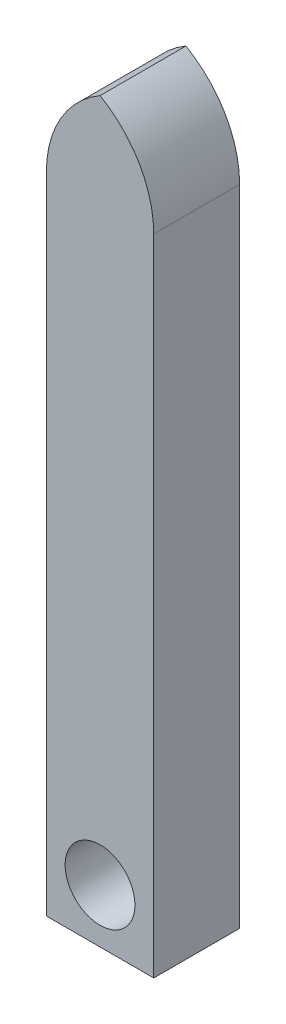
from build123d import *

# Parameters (mm, degrees)
SKETCH1_W           = 5
SKETCH1_H           = 35
SKETCH1_R           = 1.625
BOSS_EXTRUDE1_DEPTH = 4
FILLET1_R           = 5


with BuildPart() as part:
    # Sketch1 → Boss-Extrude1 (new body)
    with BuildSketch(Plane.XY):
        Rectangle(SKETCH1_W, SKETCH1_H)
        with Locations((0, -15)):
            Circle(SKETCH1_R, mode=Mode.SUBTRACT)
    extrude(amount=BOSS_EXTRUDE1_DEPTH)

    # Fillet1
    # the kernel refuses this fillet: 5 mm, written as the material it takes off along each edge
    with BuildSketch(Plane(origin=(-2.5, 17.5, -12.5), x_dir=(1, 0, 0), z_dir=(0, 0, 1)), Plane(origin=(2.5, 17.5, -12.5), x_dir=(0, -1, 0), z_dir=(0, 0, 1))) as fillet1_piece_1:
        with BuildLine():
            CenterArc((FILLET1_R, -FILLET1_R), FILLET1_R, 90, 90)
            Line((0, -FILLET1_R), (0, 0))
            Line((0, 0), (FILLET1_R, 0))
        make_face()
    extrude(amount=29, mode=Mode.SUBTRACT)


solid = part.part
